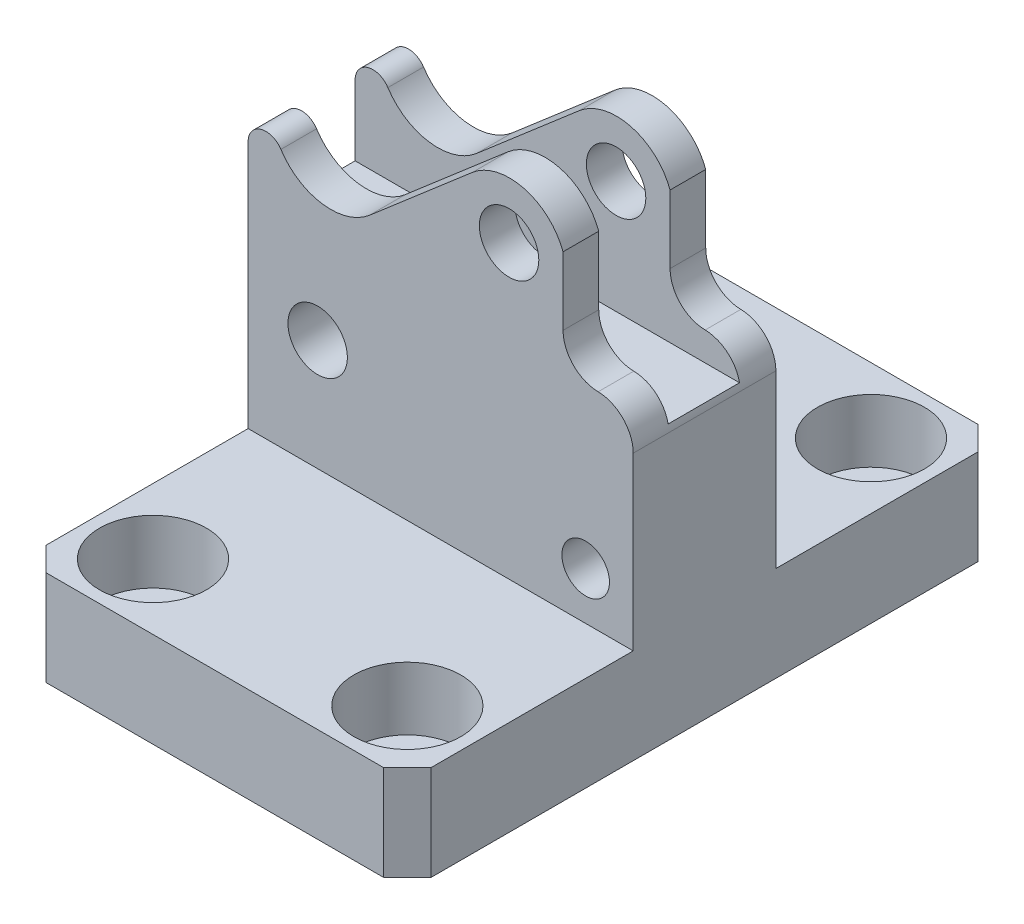
from build123d import *

# Parameters (mm, degrees)
EXTRUDE_1_DEPTH              = 35
SKETCH_2_W                   = 82.468710257
SKETCH_2_H                   = 88.660900106
CUT_EXTRUDE_1_DEPTH          = 40
SKETCH_10_R                  = 2.5
CUT_EXTRUDE_6_DEPTH          = 48.259263975
SKETCH_11_R                  = 2.5
CUT_EXTRUDE_7_DEPTH          = 48.259263975
SKETCH_13_R                  = 2
CUT_EXTRUDE_8_DEPTH          = 48.259263975
FILLET_1_R                   = 3
SKETCH_14_W                  = 32.391015019
SKETCH_14_H                  = 50
EXTRUDE_2_DEPTH              = 8
CHAMFER_1_SIZE               = 2
HOLE_WIZARD_M5_1_D           = 5.5
HOLE_WIZARD_M5_1_CBORE_D     = 9
HOLE_WIZARD_M5_1_CBORE_DEPTH = 5.3


with BuildPart() as part:
    # 草圖1 → 填料-伸長1 (new body)
    with BuildSketch(Plane(origin=(0, 0, 0), x_dir=(0, 0, -1), z_dir=(1, 0, 0))):
        Polygon((-13.9, 3), (-25.9, 3), (-25.9, 38), (-22.9, 38), (-22.9, 18), (-16.9, 18), (-16.9, 38), (-13.9, 38), align=None)
    extrude(amount=-EXTRUDE_1_DEPTH)

    # 草圖2 → 除料-伸長1 (cut)
    with BuildSketch(Plane.XY.offset(13.9)):
        with Locations((-13.573394444, 11.892084287)):
            Rectangle(SKETCH_2_W, SKETCH_2_H)
        with BuildLine():
            Line((-32.391015019, 23.817806702), (-32.391015019, 3))
            Line((-32.391015019, 3), (0, 3))
            Line((0, 3), (0, 20.4))
            Line((0, 20.4), (-2.9, 20.4))
            ThreePointArc((-2.9, 20.4), (-5.021320344, 21.278679656), (-5.9, 23.4))
            Line((-5.9, 23.4), (-5.9, 29.121329309))
            ThreePointArc((-5.9, 29.121329309), (-9.201633351, 32.099001439), (-13.531412968, 31.088891261))
            Line((-13.531412968, 31.088891261), (-22.178800852, 23.645419036))
            ThreePointArc((-22.178800852, 23.645419036), (-26.149318252, 22.485359315), (-29.634828865, 24.712905667))
            ThreePointArc((-29.634828865, 24.712905667), (-31.356390105, 25.322962362), (-32.391015019, 23.817806702))
        make_face(mode=Mode.SUBTRACT)
    extrude(amount=CUT_EXTRUDE_1_DEPTH, mode=Mode.SUBTRACT)

    # 草圖10 → 除料-伸長6 (cut, through all)
    with BuildSketch(Plane.XY.offset(25.9)):
        with Locations((-10.44068936, 27.5)):
            Circle(SKETCH_10_R)
    extrude(amount=-CUT_EXTRUDE_6_DEPTH, mode=Mode.SUBTRACT)

    # 草圖11 → 除料-伸長7 (cut, through all)
    with BuildSketch(Plane.XY.offset(25.9)):
        with Locations((-26.54068936, 12.35)):
            Circle(SKETCH_11_R)
    extrude(amount=-CUT_EXTRUDE_7_DEPTH, mode=Mode.SUBTRACT)

    # 草圖13 → 除料-伸長8 (cut, through all)
    with BuildSketch(Plane.XY.offset(25.9)):
        with Locations((-4, 7)):
            Circle(SKETCH_13_R)
    extrude(amount=-CUT_EXTRUDE_8_DEPTH, mode=Mode.SUBTRACT)

    # 圓角1
    # the kernel refuses this fillet: 3 mm, written as the material it takes off along each edge
    with BuildSketch(Plane(origin=(0, 20.4, 15.402083478), x_dir=(0, -1, 0), z_dir=(0, 0, 1)), Plane(origin=(0, 20.4, 6.402083478), x_dir=(0, -1, 0), z_dir=(0, 0, 1))) as fillet_1_piece_1:
        with BuildLine():
            CenterArc((2.999166609, -3), FILLET_1_R, 90, 89.045026126)
            Line((-0.000416696, -2.95), (-0.300375026, -2.945))
            ThreePointArc((-0.300375026, -2.945), (-0.3, -2.9), (-0.3, 0))
            Line((-0.3, 0), (0, 0.3))
            Line((0, 0.3), (2.999166609, 0.3))
            Line((2.999166609, 0.3), (2.999166609, 0))
        make_face()
    extrude(amount=17.995833044, mode=Mode.SUBTRACT)

    # 草圖14 → 填料-伸長2 (add)
    with BuildSketch(Plane.XZ.offset(-3)):
        with Locations((-16.19550751, 19.9)):
            Rectangle(SKETCH_14_W, SKETCH_14_H)
    extrude(amount=EXTRUDE_2_DEPTH)

    # 導角1
    chamfer_1_edges = [part.edges().sort_by_distance(p)[0] for p in [
        (-32.391015019, -1, -5.1),
        (0, -1, -5.1),
        (-32.391015019, -1, 44.9),
        (0, -1, 44.9),
    ]]
    chamfer(chamfer_1_edges, length=CHAMFER_1_SIZE)

    # M5 內六角圓柱頭螺釘的柱孔1 (through all)
    with Locations(Plane(origin=(0, 3, 0), x_dir=(1, 0, 0), z_dir=(0, 1, 0))):
        with Locations((-26.891015019, -0.4), (-5.5, -0.4), (-5.5, -39.4), (-26.891015019, -39.4)):
            CounterBoreHole(HOLE_WIZARD_M5_1_D / 2, HOLE_WIZARD_M5_1_CBORE_D / 2, HOLE_WIZARD_M5_1_CBORE_DEPTH)


solid = part.part
